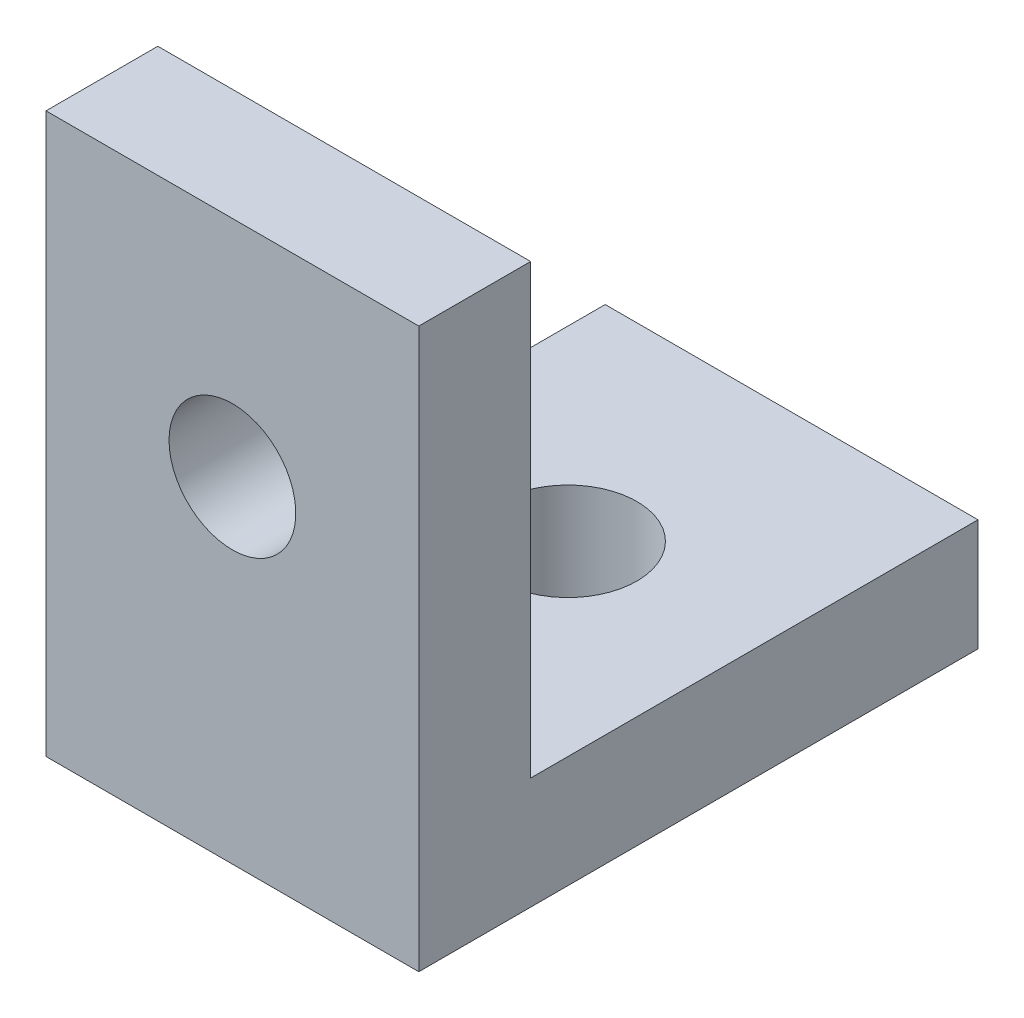
from build123d import *

# Parameters (mm, degrees)
BOSS_EXTRUDE1_DEPTH = 10
SKETCH2_R           = 1.85
CUT_EXTRUDE1_DEPTH  = 20.697715604
SKETCH4_R           = 1.7
CUT_EXTRUDE2_DEPTH  = 20.697715604


with BuildPart() as part:
    # Sketch1 → Boss-Extrude1 (new body)
    with BuildSketch(Plane(origin=(0, 0, 0), x_dir=(0, 0, -1), z_dir=(1, 0, 0))):
        Polygon((-3, 12), (0, 12), (0, 0), (12, 0), (12, -3), (-3, -3), align=None)
    extrude(amount=BOSS_EXTRUDE1_DEPTH)

    # Sketch2 → Cut-Extrude1 (cut, through all)
    with BuildSketch(Plane(origin=(0, 0, 0), x_dir=(1, 0, 0), z_dir=(0, 1, 0))):
        with Locations((5, 6)):
            Circle(SKETCH2_R)
    extrude(amount=-CUT_EXTRUDE1_DEPTH, mode=Mode.SUBTRACT)

    # Sketch4 → Cut-Extrude2 (cut, through all)
    with BuildSketch(Plane(origin=(0, 0, 0), x_dir=(-1, 0, 0), z_dir=(0, 0, -1))):
        with Locations((-5, 6)):
            Circle(SKETCH4_R)
    extrude(amount=-CUT_EXTRUDE2_DEPTH, mode=Mode.SUBTRACT)


solid = part.part
